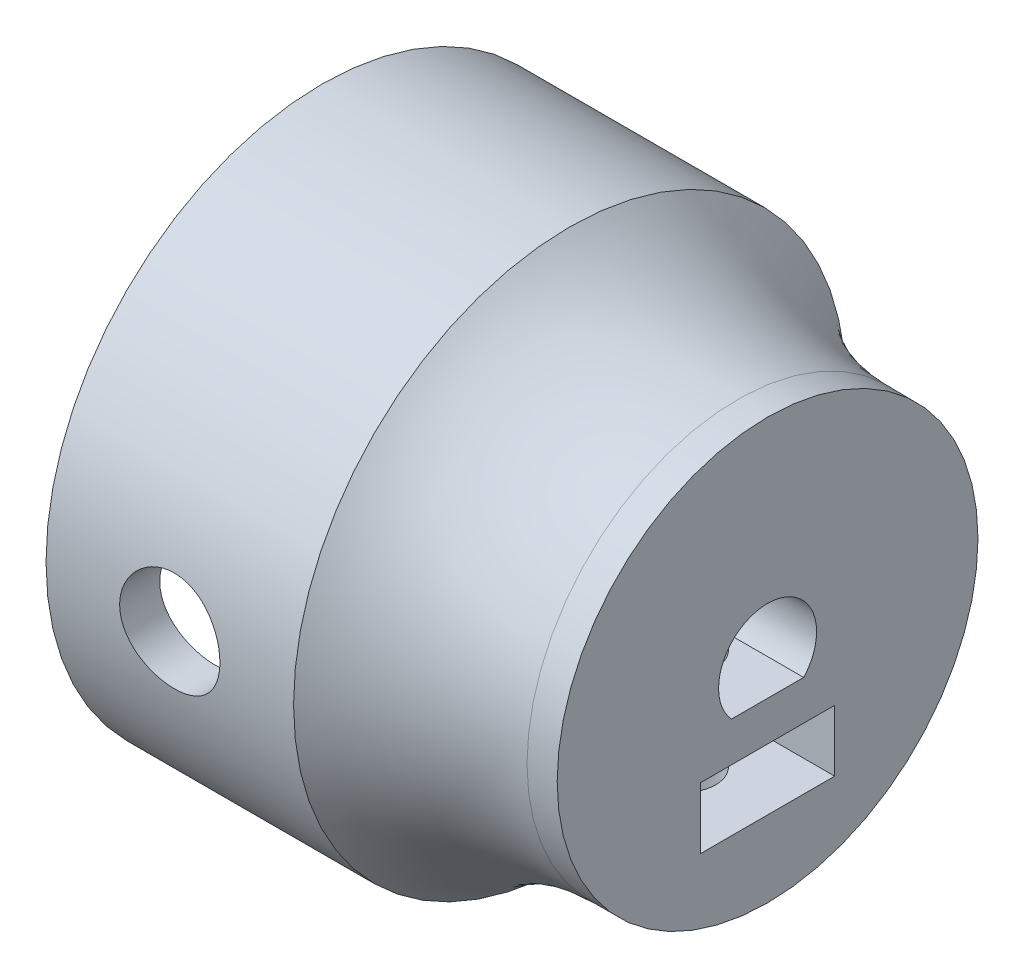
from build123d import *

# Parameters (mm, degrees)
CROQUIS1_R                 = 8.5
SALIENTE_EXTRUIR1_DEPTH    = 15
CORTAR_EXTRUIR1_DEPTH      = 9
CROQUIS9_R                 = 11.15
SALIENTE_EXTRUIR5_DEPTH    = 10
CROQUIS3_R                 = 9.53
CORTAR_EXTRUIR2_DEPTH      = 9
CORTAR_EXTRUIR4_DEPTH      = 22.763386685
CORTAR_EXTRUIR4_DEPTH_BACK = 22.763386685
CROQUIS5_R                 = 2.025
CROQUIS7_R                 = 8.5
SALIENTE_EXTRUIR3_DEPTH    = 3
CROQUIS10_W                = 5.42
CROQUIS10_H                = 2.48
CORTAR_EXTRUIR5_DEPTH      = 6
CROQUIS12_R                = 1.25
CORTAR_EXTRUIR6_DEPTH      = 24.930002183


with BuildPart() as part:
    # Croquis1 → Saliente-Extruir1 (new body)
    with BuildSketch(Plane(origin=(0, 0, 0), x_dir=(0, 0, -1), z_dir=(1, 0, 0))):
        Circle(CROQUIS1_R)
    extrude(amount=SALIENTE_EXTRUIR1_DEPTH)

    # Croquis2 → Cortar-Extruir1 (cut)
    with BuildSketch(Plane(origin=(15, 0, 0), x_dir=(0, 0, -1), z_dir=(1, 0, 0))):
        with BuildLine():
            Line((-1.457669373, -1.34), (1.457669373, -1.34))
            ThreePointArc((1.457669373, -1.34), (0, 1.98), (-1.457669373, -1.34))
        make_face()
    extrude(amount=-CORTAR_EXTRUIR1_DEPTH, mode=Mode.SUBTRACT)

    # Croquis9 → Saliente-Extruir5 (add)
    with BuildSketch(Plane.ZY):
        Circle(CROQUIS9_R)
    extrude(amount=-SALIENTE_EXTRUIR5_DEPTH)

    # Croquis3 → Cortar-Extruir2 (cut)
    with BuildSketch(Plane.ZY):
        Circle(CROQUIS3_R)
    extrude(amount=-CORTAR_EXTRUIR2_DEPTH, mode=Mode.SUBTRACT)

    # Croquis5 → Cortar-Extruir4 (cut, two sides: drawn at the far end of the back side and taken through both)
    with BuildSketch(Plane.XY.offset(-CORTAR_EXTRUIR4_DEPTH_BACK)):
        with Locations((5, 0)):
            Circle(CROQUIS5_R)
    extrude(amount=CORTAR_EXTRUIR4_DEPTH + CORTAR_EXTRUIR4_DEPTH_BACK, mode=Mode.SUBTRACT)

    # Croquis7 → Saliente-Extruir3 (add)
    with BuildSketch(Plane(origin=(15, 0, 0), x_dir=(0, 0, -1), z_dir=(1, 0, 0))):
        with Locations(Location((0, 0, 0), (0, 0, 180))):
            Circle(CROQUIS7_R)
        with BuildLine():
            Line((-1.457669373, -1.34), (1.457669373, -1.34))
            ThreePointArc((1.457669373, -1.34), (0, 1.98), (-1.457669373, -1.34))
        make_face(mode=Mode.SUBTRACT)
    extrude(amount=SALIENTE_EXTRUIR3_DEPTH)

    # Redondeo1: read off the stored shape, not the designer's step
    # Redondeo1 outline → Redondeo1 (revolve)
    with BuildSketch(Plane.YX):
        with BuildLine():
            Line((8.5, 10), (11.15, 10))
            ThreePointArc((11.15, 10), (9.186031995, 13.140616114), (8.5, 16.780671058))
            Line((8.5, 16.780671058), (8.5, 10))
        make_face()
    revolve(axis=Axis((0, 0, 0), (1, 0, 0)))

    # Croquis10 → Cortar-Extruir5 (cut)
    with BuildSketch(Plane(origin=(18, 0, 0), x_dir=(0, 0, -1), z_dir=(1, 0, 0))):
        with Locations((0, -4.18)):
            Rectangle(CROQUIS10_W, CROQUIS10_H)
    extrude(amount=-CORTAR_EXTRUIR5_DEPTH, mode=Mode.SUBTRACT)

    # Croquis12 → Cortar-Extruir6 (cut, through all)
    with BuildSketch(Plane(origin=(0, 0, 0), x_dir=(1, 0, 0), z_dir=(0, 1, 0))):
        with Locations(Location((14.65, 0, 0), (0, 0, 140.139668223))):
            Circle(CROQUIS12_R)
    extrude(amount=-CORTAR_EXTRUIR6_DEPTH, mode=Mode.SUBTRACT)


solid = part.part
